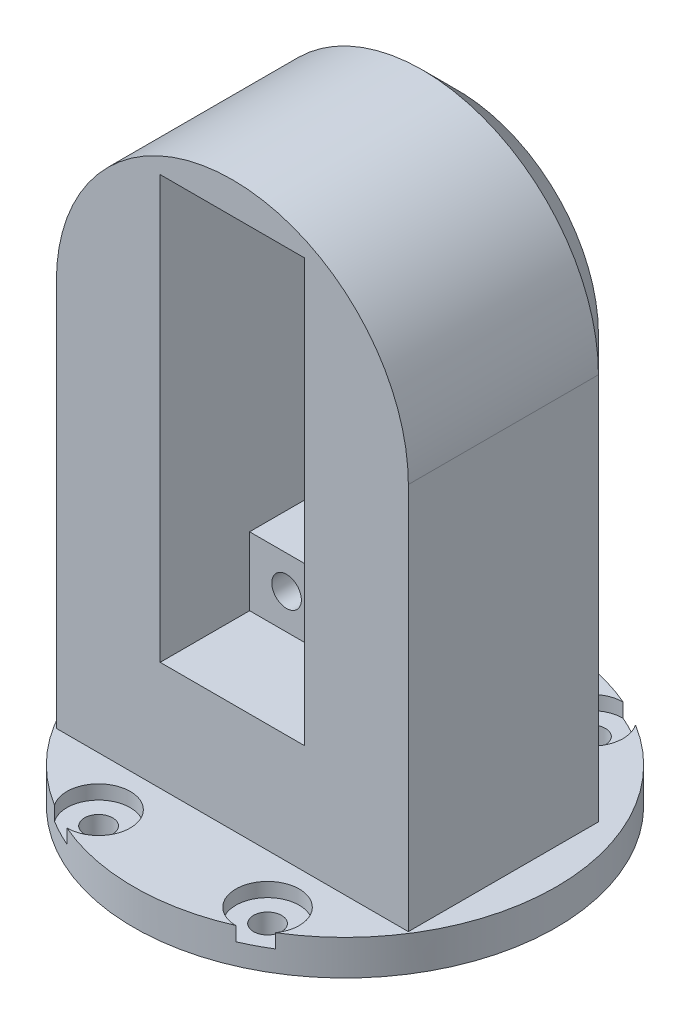
from build123d import *

# Parameters (mm, degrees)
BOSS_EXTRUDE1_DEPTH = 16
CHAMFER1_SIZE       = 5
CUT_EXTRUDE1_DEPTH  = 10.25
SKETCH5_W           = 6.4
SKETCH5_H           = 6.71
CUT_EXTRUDE2_DEPTH  = 24
CUT_EXTRUDE3_DEPTH  = 10
FILLET1_R           = 15
CHAMFER2_SIZE       = 3
SKETCH7_R           = 30
SKETCH7_R_2         = 2
BOSS_EXTRUDE2_DEPTH = 5
SKETCH8_R           = 4.5
CUT_EXTRUDE4_DEPTH  = 2


# Some blends are built 0.0001 mm under size
with BuildPart() as part:
    # Sketch1 → Boss-Extrude1 (new, symmetric)
    with BuildSketch(Plane.XY):
        with BuildLine():
            Line((25, 51), (-25, 51))
            Line((-25, 51), (-25, 111))
            ThreePointArc((-25, 111), (0, 136), (25, 111))
            Line((25, 111), (25, 51))
        make_face()
    extrude(amount=BOSS_EXTRUDE1_DEPTH, both=True)

    # Chamfer1
    chamfer1_edges = [part.edges().sort_by_distance(p)[0] for p in [
        (25, 81, -16),
        (-25, 81, -16),
        (0, 136, -16),
    ]]
    chamfer(chamfer1_edges, length=CHAMFER1_SIZE)

    # Sketch3 → Cut-Extrude1 (cut, symmetric)
    with BuildSketch(Plane(origin=(0, 0, 0), x_dir=(0, 0, -1), z_dir=(1, 0, 0))):
        Polygon((-3.3, 121.79), (-3.3, 131.5), (-16, 131.5), (-16, 101.5), (16, 101.5), (16, 121.79), align=None)
    cut_extrude1 = extrude(amount=CUT_EXTRUDE1_DEPTH, both=True, mode=Mode.SUBTRACT)

    # Sketch4 → Cut-Revolve1 (revolve, cut)
    with BuildSketch(Plane(origin=(-5, 0, 0), x_dir=(0, 0, -1), z_dir=(1, 0, 0)), mode=Mode.PRIVATE) as cut_revolve1_sk:
        Polygon((-3.3, 126.5), (6.7, 126.5), (6.7, 127.85), (2.7, 127.85), (2.7, 128.6), (-3.3, 128.6), align=None)
    cut_revolve1 = revolve(cut_revolve1_sk.sketch.rotate(Axis((-5, 126.5, 3.3), (0, 0, -1)), 90), axis=Axis((-5, 126.5, 3.3), (0, 0, -1)), mode=Mode.SUBTRACT)

    # Mirror1: Cut-Revolve1 across plane
    add(cut_revolve1.mirror(Plane(origin=(0, 0, 0), x_dir=(0, 0, 1), z_dir=(1, 0, 0))), mode=Mode.SUBTRACT)

    # Mirror2: Cut-Extrude1, Cut-Revolve1 across plane
    add(cut_extrude1.mirror(Plane(origin=(-10.25, 101.5, -16), x_dir=(0, 0, 1), z_dir=(0, -1, 0))), mode=Mode.SUBTRACT)
    add(cut_revolve1.mirror(Plane(origin=(-10.25, 101.5, -16), x_dir=(0, 0, 1), z_dir=(0, -1, 0))), mode=Mode.SUBTRACT)

    # Mirror2 copy 1 sketch → Mirror2 copy 1 (revolve, cut)
    with BuildSketch(Plane(origin=(5, 203, 0), x_dir=(0, 0, -1), z_dir=(-1, 0, 0))):
        Polygon((-3.3, 126.5), (6.7, 126.5), (6.7, 127.85), (2.7, 127.85), (2.7, 128.6), (-3.3, 128.6), align=None)
    revolve(axis=Axis((5, 76.5, 3.3), (0, 0, -1)), mode=Mode.SUBTRACT)

    # Sketch5 → Cut-Extrude2 (cut)
    with BuildSketch(Plane.XY.offset(3.3)):
        with Locations((0, 125.145)):
            Rectangle(SKETCH5_W, SKETCH5_H)
    extrude(amount=-CUT_EXTRUDE2_DEPTH, mode=Mode.SUBTRACT)

    # Sketch6 → Cut-Extrude3 (cut)
    with BuildSketch(Plane(origin=(0, 0, -16), x_dir=(-1, 0, 0), z_dir=(0, 0, -1))):
        with BuildLine():
            Line((-15, 111), (-15, 56))
            Line((-15, 56), (15, 56))
            Line((15, 56), (15, 111))
            ThreePointArc((15, 111), (0, 126), (-15, 111))
        make_face()
    extrude(amount=-CUT_EXTRUDE3_DEPTH, mode=Mode.SUBTRACT)

    # Fillet1
    fillet1_edges = [part.edges().sort_by_distance(p)[0] for p in [
        (-15, 56, -11),
        (15, 56, -11),
    ]]
    fillet(fillet1_edges, radius=FILLET1_R - 0.0001)  # a hair under: the kernel refuses the full size

    # Chamfer2
    # the kernel refuses this chamfer: 3 mm, written as the material it takes off along each edge
    with BuildSketch(Plane(origin=(-15, 70.9999, -16), x_dir=(-0.9996219169112965, 0, -0.02749587661058676), z_dir=(0, 1, 0)), Plane(origin=(15, 111, -16), x_dir=(0.9996219169112965, 0, -0.02749587661058676), z_dir=(0, -1, 0))) as chamfer2_piece_1:
        Polygon((CHAMFER2_SIZE * 0.999621916911, CHAMFER2_SIZE * 0.0274958766106), (-CHAMFER2_SIZE * 0.0274958766106, CHAMFER2_SIZE * 0.999621916911), (0, 0), align=None)
    extrude(amount=40.0001, mode=Mode.SUBTRACT)
    with BuildSketch(Plane(origin=(-0.0001, 70.9999, -16), x_dir=(0, -1, 0), z_dir=(1, 0, 0))) as chamfer2_piece_2:
        Polygon((14.9999 + CHAMFER2_SIZE, 0), (14.9999, -CHAMFER2_SIZE), (14.9999, 0), align=None)
    revolve(axis=Axis((-0.0001, 70.9999, -16), (0, 0, -1)), revolution_arc=90, mode=Mode.SUBTRACT)
    with BuildSketch(Plane(origin=(0, 111, -16), x_dir=(-0.29504722278554535, 0.955482671913278, 0), z_dir=(-0.955482671913278, -0.29504722278554535, 0))) as chamfer2_piece_3:
        Polygon((15 + CHAMFER2_SIZE, 0), (15, -CHAMFER2_SIZE), (15, 0), align=None)
    revolve(axis=Axis((0, 111, -16), (0, 0, -1)), revolution_arc=107.160369077, mode=Mode.SUBTRACT)
    with BuildSketch(Plane(origin=(0.0001, 70.9999, -16), x_dir=(1, 0, 0), z_dir=(0, 1, 0))) as chamfer2_piece_4:
        Polygon((14.9999 + CHAMFER2_SIZE, 0), (14.9999, -CHAMFER2_SIZE), (14.9999, 0), align=None)
    revolve(axis=Axis((0.0001, 70.9999, -16), (0, 0, -1)), revolution_arc=90, mode=Mode.SUBTRACT)
    with BuildSketch(Plane(origin=(0.0001, 56, -16), x_dir=(0, -0.9996219169112965, -0.02749587661058676), z_dir=(-1, 0, 0))) as chamfer2_piece_5:
        Polygon((CHAMFER2_SIZE * 0.999621916911, CHAMFER2_SIZE * 0.0274958766106), (-CHAMFER2_SIZE * 0.0274958766106, CHAMFER2_SIZE * 0.999621916911), (0, 0), align=None)
    extrude(amount=0.0002, mode=Mode.SUBTRACT)
    with BuildSketch(Plane(origin=(0, 111, -16), x_dir=(-1, 0, 0), z_dir=(0, -1, 0))) as chamfer2_piece_6:
        Polygon((15 + CHAMFER2_SIZE, 0), (15, -CHAMFER2_SIZE), (15, 0), align=None)
    revolve(axis=Axis((0, 111, -16), (0, 0, -1)), revolution_arc=107.160369077, mode=Mode.SUBTRACT)

    # Sketch7 → Boss-Extrude2 (add)
    with BuildSketch(Plane.XZ.offset(-51)):
        with Locations(Location((0, 0, 0), (0, 0, 270))):
            Circle(SKETCH7_R)
        with Locations(Location((-12, -23, 0), (0, 0, 270))):
            Circle(SKETCH7_R_2, mode=Mode.SUBTRACT)
        with Locations(Location((12, -23, 0), (0, 0, 270))):
            Circle(SKETCH7_R_2, mode=Mode.SUBTRACT)
        with Locations(Location((-12, 23, 0), (0, 0, 270))):
            Circle(SKETCH7_R_2, mode=Mode.SUBTRACT)
        with Locations(Location((12, 23, 0), (0, 0, 270))):
            Circle(SKETCH7_R_2, mode=Mode.SUBTRACT)
    extrude(amount=-BOSS_EXTRUDE2_DEPTH)

    # Sketch8 → Cut-Extrude4 (cut)
    with BuildSketch(Plane(origin=(0, 56, 0), x_dir=(1, 0, 0), z_dir=(0, 1, 0))):
        with Locations((12, 23)):
            Circle(SKETCH8_R)
        with Locations((-12, 23)):
            Circle(SKETCH8_R)
        with Locations((-12, -23)):
            Circle(SKETCH8_R)
        with Locations((12, -23)):
            Circle(SKETCH8_R)
    extrude(amount=-CUT_EXTRUDE4_DEPTH, mode=Mode.SUBTRACT)


solid = part.part
